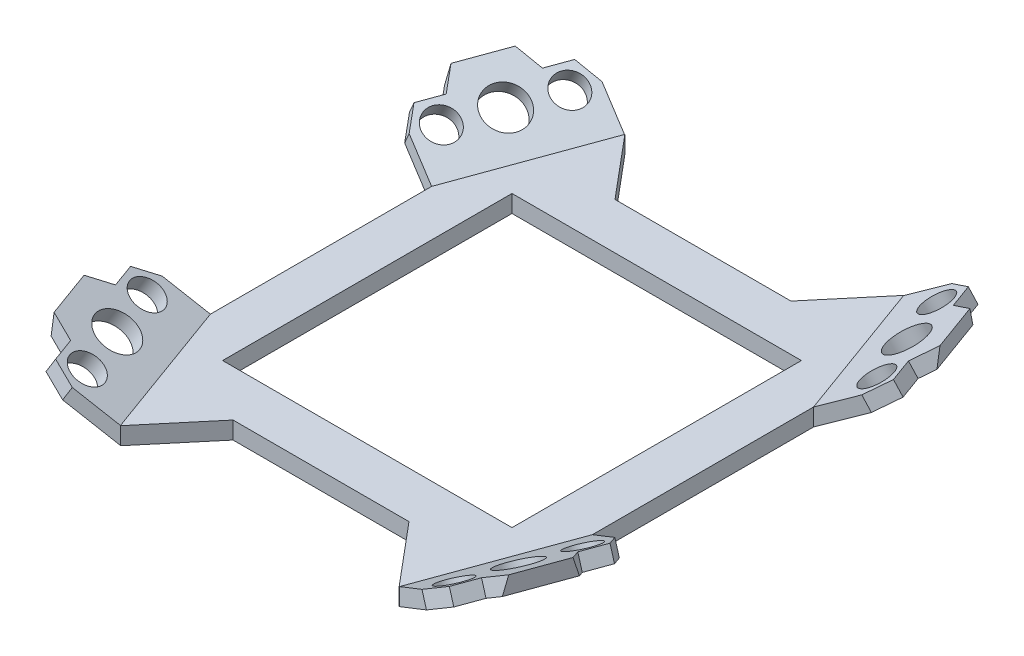
from build123d import *

# Parameters (mm, degrees)
SKETCH11_W                = 100
SKETCH11_H                = 100
BOSS_EXTRUDE6_DEPTH       = 6
BOSS_EXTRUDE7_DEPTH       = 52
SKETCH13_R                = 5.5
SKETCH13_R_2              = 7
CUT_EXTRUDE1_DEPTH        = 133.635081928
MIRROR4_COPY_1_DEPTH      = 52
MIRROR4_COPY_2_SKETCH_R   = 5.5
MIRROR4_COPY_2_SKETCH_R_2 = 7
MIRROR4_COPY_2_DEPTH      = 133.635081928


with BuildPart() as part:
    # Sketch11 → Boss-Extrude6 (new body)
    with BuildSketch(Plane(origin=(0, 0, 0), x_dir=(1, 0, 0), z_dir=(0, 1, 0))):
        Polygon((-30.40590263, -66), (30.40590263, -66), (48.180396376, -87.182816779), (65.965443829, -38.318800498), (66, -38.223858198), (66, 38.223858198), (65.965443829, 38.318800498), (48.180396376, 87.182816779), (30.40590263, 66), (-30.40590263, 66), (-48.180396376, 87.182816779), (-65.965443829, 38.318800498), (-66, 38.223858198), (-66, 0), (-66, -38.223858198), (-65.965443829, -38.318800498), (-48.180396376, -87.182816779), align=None)
        Rectangle(SKETCH11_W, SKETCH11_H, mode=Mode.SUBTRACT)
    extrude(amount=BOSS_EXTRUDE6_DEPTH)

    # Sketch12 → Boss-Extrude7 (add)
    with BuildSketch(Plane(origin=(4.564377845, 0, -12.540525063), x_dir=(0, -1, 0), z_dir=(0.34202014332568775, 0, -0.9396926207859015))):
        Polygon((-6, 75.093042431), (-21, 101.073804545), (-15, 101.073804545), (0, 75.093042431), align=None)
    boss_extrude7 = extrude(amount=BOSS_EXTRUDE7_DEPTH)

    # Sketch13 → Cut-Extrude1 (cut, through all)
    with BuildSketch(Plane(origin=(-15.199701417, -28.016241197, -5.532238886), x_dir=(0.8827482339886774, -0.46094551652187815, -0.0910208008548064), z_dir=(0.4698463103929532, 0.8660254037844399, 0.17101007166283053))):
        with Locations((-68.013196342, 52.475844075)):
            Circle(SKETCH13_R)
        with Locations((-61.30257529, 68.442996768)):
            Circle(SKETCH13_R_2)
        with Locations((-54.591954239, 84.41014946)):
            Circle(SKETCH13_R)
        Polygon((-78.486349739, 66.270925012), (-73.26181099, 59.388877739), (-76.624673648, 51.387331963), (-71.376255853, 44.473829908), (-85.204621349, 50.285568695), align=None)
        Polygon((-51.228894728, 92.412163627), (-59.839867968, 91.323715229), (-63.202730626, 83.322169453), (-71.775531833, 82.238546095), (-65.057260223, 98.223902413), align=None)
    cut_extrude1 = extrude(amount=-CUT_EXTRUDE1_DEPTH, mode=Mode.SUBTRACT)

    # Mirror3: Boss-Extrude7, Cut-Extrude1 across plane
    add(boss_extrude7.mirror(Plane(origin=(0, 0, 0), x_dir=(0, 0, 1), z_dir=(1, 0, 0))))
    add(cut_extrude1.mirror(Plane(origin=(0, 0, 0), x_dir=(0, 0, 1), z_dir=(1, 0, 0))), mode=Mode.SUBTRACT)

    # Mirror4: Boss-Extrude7, Cut-Extrude1 across plane
    add(boss_extrude7.mirror(Plane.XY))
    add(cut_extrude1.mirror(Plane.XY), mode=Mode.SUBTRACT)

    # Mirror4 copy 1 sketch → Mirror4 copy 1 (add)
    with BuildSketch(Plane(origin=(-4.564377845, 0, 12.540525063), x_dir=(0, -1, 0), z_dir=(-0.34202014332568775, 0, 0.9396926207859015))):
        Polygon((-6, 75.093042431), (-21, 101.073804545), (-15, 101.073804545), (0, 75.093042431), align=None)
    extrude(amount=MIRROR4_COPY_1_DEPTH)

    # Mirror4 copy 2 sketch → Mirror4 copy 2 (cut, through all)
    with BuildSketch(Plane(origin=(15.199701417, -28.016241197, 5.532238886), x_dir=(-0.8827482339886774, -0.46094551652187815, 0.0910208008548064), z_dir=(-0.4698463103929532, 0.8660254037844399, -0.17101007166283053))):
        with Locations((-68.013196342, 52.475844075)):
            Circle(MIRROR4_COPY_2_SKETCH_R)
        with Locations((-61.30257529, 68.442996768)):
            Circle(MIRROR4_COPY_2_SKETCH_R_2)
        with Locations((-54.591954239, 84.41014946)):
            Circle(MIRROR4_COPY_2_SKETCH_R)
        Polygon((-78.486349739, 66.270925012), (-73.26181099, 59.388877739), (-76.624673648, 51.387331963), (-71.376255853, 44.473829908), (-85.204621349, 50.285568695), align=None)
        Polygon((-51.228894728, 92.412163627), (-59.839867968, 91.323715229), (-63.202730626, 83.322169453), (-71.775531833, 82.238546095), (-65.057260223, 98.223902413), align=None)
    extrude(amount=-MIRROR4_COPY_2_DEPTH, mode=Mode.SUBTRACT)


solid = part.part
